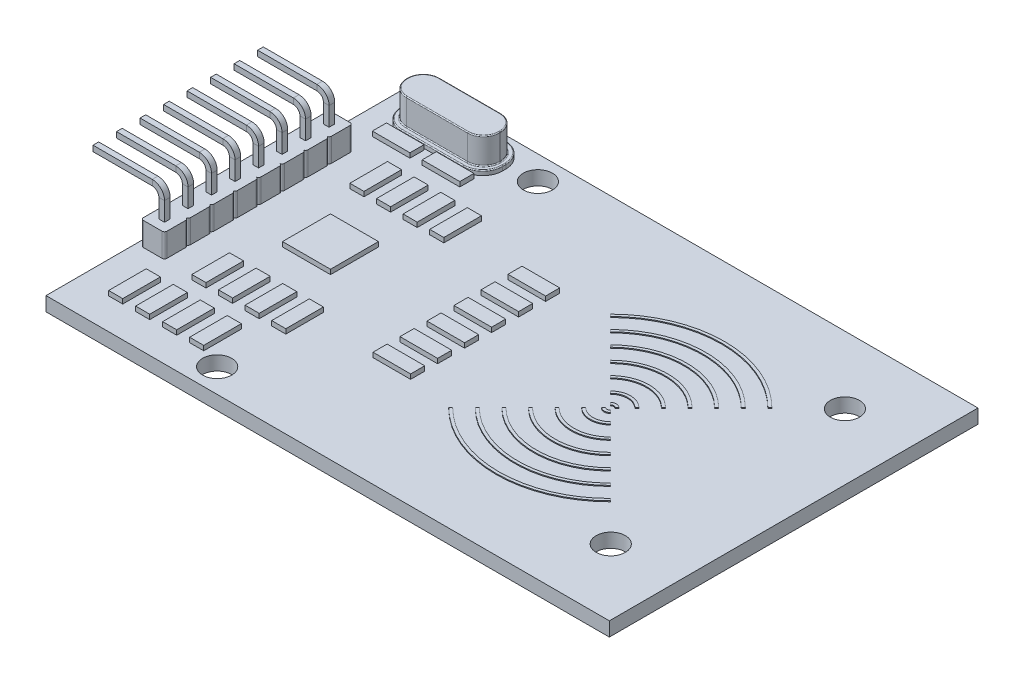
from build123d import *

# Parameters (mm, degrees)
SKETCH1_W               = 59.9
SKETCH1_H               = 39.2
BOSS_EXTRUDE1_DEPTH     = 1.5
SKETCH2_R               = 1.55
CUT_EXTRUDE4_DEPTH      = 1.5
SKETCH3_W               = 2.5
SKETCH3_H               = 2.5
BOSS_EXTRUDE2_DEPTH     = 2.5
FILLET1_R               = 0.25
LPATTERN2_START         = 1.5
LPATTERN2_DEPTH         = 2.5
SKETCH4_W               = 0.6
SKETCH4_H               = 0.6
CUT_EXTRUDE5_DEPTH      = 37.016142214
LPATTERN3_COUNT         = 8
LPATTERN3_PITCH         = 2.5
SKETCH6_W               = 0.6
SKETCH6_H               = 0.6
LPATTERN4_COUNT         = 8
LPATTERN4_PITCH         = 2.5
BOSS_EXTRUDE3_DEPTH     = 0.5
BOSS_EXTRUDE4_DEPTH     = 2.8
FILLET2_R               = 0.1
BOSS_EXTRUDE5_DEPTH     = 0.1
SKETCH14_W              = 5.1
SKETCH14_H              = 5.1
BOSS_EXTRUDE6_DEPTH     = 0.5
SKETCH15_W              = 4
SKETCH15_H              = 1.5
BOSS_EXTRUDE7_DEPTH     = 0.5
LPATTERN5_COUNT         = 6
LPATTERN5_PITCH         = 2.87
SKETCH16_W              = 1.5
SKETCH16_H              = 4
BOSS_EXTRUDE8_DEPTH     = 0.5
LPATTERN6_COUNT         = 4
LPATTERN6_PITCH         = 2.83
MIRROR2_COPY_1_SKETCH_W = 1.5
MIRROR2_COPY_1_SKETCH_H = 4
MIRROR2_COPY_1_DEPTH    = 0.5
MIRROR2_COPY_2_SKETCH_W = 1.5
MIRROR2_COPY_2_SKETCH_H = 4
MIRROR2_COPY_2_DEPTH    = 0.5
MIRROR2_COPY_3_SKETCH_W = 1.5
MIRROR2_COPY_3_SKETCH_H = 4
MIRROR2_COPY_3_DEPTH    = 0.5
SKETCH17_W              = 1.5
SKETCH17_H              = 4
BOSS_EXTRUDE9_DEPTH     = 0.5
LPATTERN7_COUNT         = 4
LPATTERN7_PITCH         = 2.87
SKETCH18_W              = 4
SKETCH18_H              = 1.5
BOSS_EXTRUDE10_DEPTH    = 0.5
LPATTERN8_COUNT         = 2
LPATTERN8_PITCH         = 5.3


# Read off the part's stored shape, not the designer's step: LPattern2
with BuildPart() as part:
    # Sketch1 → Boss-Extrude1 (new body)
    with BuildSketch(Plane(origin=(0, 0, 0), x_dir=(1, 0, 0), z_dir=(0, 1, 0))):
        Rectangle(SKETCH1_W, SKETCH1_H)
    extrude(amount=BOSS_EXTRUDE1_DEPTH)

    # Sketch2 → Cut-Extrude4 (cut)
    with BuildSketch(Plane(origin=(0, 0, 0), x_dir=(1, 0, 0), z_dir=(0, 1, 0))):
        with Locations(Location((-14.3, 17.05, 0), (0, 0, 270))):
            Circle(SKETCH2_R)
        with Locations(Location((22.95, 12.45, 0), (0, 0, 270))):
            Circle(SKETCH2_R)
        with Locations(Location((22.95, -12.45, 0), (0, 0, 90))):
            Circle(SKETCH2_R)
        with Locations(Location((-14.3, -17.05, 0), (0, 0, 90))):
            Circle(SKETCH2_R)
    extrude(amount=CUT_EXTRUDE4_DEPTH, mode=Mode.SUBTRACT)

    # Sketch3 → Boss-Extrude2 (add)
    with BuildSketch(Plane(origin=(0, 1.5, 0), x_dir=(1, 0, 0), z_dir=(0, 1, 0))):
        with Locations((-28.2, 8.75)):
            Rectangle(SKETCH3_W, SKETCH3_H)
    extrude(amount=BOSS_EXTRUDE2_DEPTH)

    # Fillet1
    fillet1_edges = [part.edges().sort_by_distance(p)[0] for p in [
        (-29.45, 2.75, -7.5),
        (-26.95, 2.75, -7.5),
        (-26.95, 2.75, -10),
        (-29.45, 2.75, -10),
    ]]
    fillet(fillet1_edges, radius=FILLET1_R)

    # LPattern2 outline → LPattern2 (add)
    with BuildSketch(Plane(origin=(0, 0, 0), x_dir=(1, 0, 0), z_dir=(0, 1, 0)).offset(LPATTERN2_START)):
        with BuildLine():
            Line((-26.95, 5.25), (-26.95, 7.25))
            ThreePointArc((-26.95, 7.25), (-27.023223305, 7.426776695), (-27.2, 7.5))
            Line((-27.2, 7.5), (-29.2, 7.5))
            ThreePointArc((-29.2, 7.5), (-29.376776695, 7.426776695), (-29.45, 7.25))
            Line((-29.45, 7.25), (-29.45, 5.25))
            ThreePointArc((-29.45, 5.25), (-29.376776695, 5.073223305), (-29.2, 5))
            ThreePointArc((-29.2, 5), (-29.376776695, 4.926776695), (-29.45, 4.75))
            Line((-29.45, 4.75), (-29.45, 2.75))
            ThreePointArc((-29.45, 2.75), (-29.376776695, 2.573223305), (-29.2, 2.5))
            ThreePointArc((-29.2, 2.5), (-29.376776695, 2.426776695), (-29.45, 2.25))
            Line((-29.45, 2.25), (-29.45, 0.25))
            ThreePointArc((-29.45, 0.25), (-29.376776695, 0.073223305), (-29.2, 0))
            ThreePointArc((-29.2, 0), (-29.376776695, -0.073223305), (-29.45, -0.25))
            Line((-29.45, -0.25), (-29.45, -2.25))
            ThreePointArc((-29.45, -2.25), (-29.376776695, -2.426776695), (-29.2, -2.5))
            ThreePointArc((-29.2, -2.5), (-29.376776695, -2.573223305), (-29.45, -2.75))
            Line((-29.45, -2.75), (-29.45, -4.75))
            ThreePointArc((-29.45, -4.75), (-29.376776695, -4.926776695), (-29.2, -5))
            ThreePointArc((-29.2, -5), (-29.376776695, -5.073223305), (-29.45, -5.25))
            Line((-29.45, -5.25), (-29.45, -7.25))
            ThreePointArc((-29.45, -7.25), (-29.376776695, -7.426776695), (-29.2, -7.5))
            ThreePointArc((-29.2, -7.5), (-29.376776695, -7.573223305), (-29.45, -7.75))
            Line((-29.45, -7.75), (-29.45, -9.75))
            ThreePointArc((-29.45, -9.75), (-29.376776695, -9.926776695), (-29.2, -10))
            Line((-29.2, -10), (-27.2, -10))
            ThreePointArc((-27.2, -10), (-27.023223305, -9.926776695), (-26.95, -9.75))
            Line((-26.95, -9.75), (-26.95, -7.75))
            ThreePointArc((-26.95, -7.75), (-27.023223305, -7.573223305), (-27.2, -7.5))
            ThreePointArc((-27.2, -7.5), (-27.023223305, -7.426776695), (-26.95, -7.25))
            Line((-26.95, -7.25), (-26.95, -5.25))
            ThreePointArc((-26.95, -5.25), (-27.023223305, -5.073223305), (-27.2, -5))
            ThreePointArc((-27.2, -5), (-27.023223305, -4.926776695), (-26.95, -4.75))
            Line((-26.95, -4.75), (-26.95, -2.75))
            ThreePointArc((-26.95, -2.75), (-27.023223305, -2.573223305), (-27.2, -2.5))
            ThreePointArc((-27.2, -2.5), (-27.023223305, -2.426776695), (-26.95, -2.25))
            Line((-26.95, -2.25), (-26.95, -0.25))
            ThreePointArc((-26.95, -0.25), (-27.023223305, -0.073223305), (-27.2, 0))
            ThreePointArc((-27.2, 0), (-27.023223305, 0.073223305), (-26.95, 0.25))
            Line((-26.95, 0.25), (-26.95, 2.25))
            ThreePointArc((-26.95, 2.25), (-27.023223305, 2.426776695), (-27.2, 2.5))
            ThreePointArc((-27.2, 2.5), (-27.023223305, 2.573223305), (-26.95, 2.75))
            Line((-26.95, 2.75), (-26.95, 4.75))
            ThreePointArc((-26.95, 4.75), (-27.023223305, 4.926776695), (-27.2, 5))
            ThreePointArc((-27.2, 5), (-27.023223305, 5.073223305), (-26.95, 5.25))
        make_face()
    extrude(amount=LPATTERN2_DEPTH)

    # Sketch4 → Cut-Extrude5 (cut, through all)
    with BuildSketch(Plane(origin=(0, 4, 0), x_dir=(1, 0, 0), z_dir=(0, 1, 0))):
        with Locations((-28.2, 8.75)):
            Rectangle(SKETCH4_W, SKETCH4_H)
    cut_extrude5 = extrude(amount=-CUT_EXTRUDE5_DEPTH, mode=Mode.SUBTRACT)

    # LPattern3: Cut-Extrude5 ×8
    with Locations(*[(0, 0, i * LPATTERN3_PITCH) for i in range(1, LPATTERN3_COUNT)]):
        add(cut_extrude5, mode=Mode.SUBTRACT)

    # Sweep1: sweep along a path in Sketch10
    with BuildLine(Plane(origin=(0, 0, -10), x_dir=(-1, 0, 0), z_dir=(0, 0, -1))) as sweep1_path:
        Line((28.2, -1), (28.2, 6))
        ThreePointArc((28.2, 6), (28.492893219, 6.707106781), (29.2, 7))
        Line((29.2, 7), (35.5, 7))
    # Sketch6 → Sweep1 (sweep)
    with BuildSketch(Plane(origin=(0, -1, 0), x_dir=(-1, 0, 0), z_dir=(0, -1, 0))):
        with Locations((28.2, 8.75)):
            Rectangle(SKETCH6_W, SKETCH6_H)
    sweep1 = sweep(path=sweep1_path.line)

    # LPattern4: Sweep1 ×8
    with Locations(*[(0, 0, i * LPATTERN4_PITCH) for i in range(1, LPATTERN4_COUNT)]):
        add(sweep1)

    # Sketch11 → Boss-Extrude3 (add)
    with BuildSketch(Plane(origin=(0, 1.5, 0), x_dir=(1, 0, 0), z_dir=(0, 1, 0))):
        with BuildLine():
            Line((-25.85, 18.6), (-19.25, 18.6))
            ThreePointArc((-19.25, 18.6), (-17.76507576, 17.98492424), (-17.15, 16.5))
            Line((-17.15, 16.5), (-17.15, 16.15))
            ThreePointArc((-17.15, 16.15), (-17.76507576, 14.66507576), (-19.25, 14.05))
            Line((-19.25, 14.05), (-25.85, 14.05))
            ThreePointArc((-25.85, 14.05), (-27.33492424, 14.66507576), (-27.95, 16.15))
            Line((-27.95, 16.15), (-27.95, 16.5))
            ThreePointArc((-27.95, 16.5), (-27.33492424, 17.98492424), (-25.85, 18.6))
        make_face()
    extrude(amount=BOSS_EXTRUDE3_DEPTH)

    # Sketch12 → Boss-Extrude4 (add)
    with BuildSketch(Plane(origin=(0, 2, 0), x_dir=(1, 0, 0), z_dir=(0, 1, 0))):
        with BuildLine():
            Line((-25.8, 18.075), (-19.3, 18.075))
            ThreePointArc((-19.3, 18.075), (-18.097918472, 17.577081528), (-17.6, 16.375))
            Line((-17.6, 16.375), (-17.6, 16.275))
            ThreePointArc((-17.6, 16.275), (-18.097918472, 15.072918472), (-19.3, 14.575))
            Line((-19.3, 14.575), (-25.8, 14.575))
            ThreePointArc((-25.8, 14.575), (-27.002081528, 15.072918472), (-27.5, 16.275))
            Line((-27.5, 16.275), (-27.5, 16.375))
            ThreePointArc((-27.5, 16.375), (-27.002081528, 17.577081528), (-25.8, 18.075))
        make_face()
    extrude(amount=BOSS_EXTRUDE4_DEPTH)

    # Fillet2
    fillet2_edges = [part.edges().sort_by_distance(p)[0] for p in [
        (-17.76507576, 2, -17.98492424),
        (-22.55, 2, -18.6),
        (-27.33492424, 2, -17.98492424),
        (-27.95, 2, -16.325),
        (-27.33492424, 2, -14.66507576),
        (-22.55, 2, -14.05),
        (-17.76507576, 2, -14.66507576),
        (-17.15, 2, -16.325),
        (-18.097918472, 2, -15.072918472),
        (-17.6, 2, -16.325),
        (-18.097918472, 2, -17.577081528),
        (-22.55, 2, -18.075),
        (-27.002081528, 2, -17.577081528),
        (-27.5, 2, -16.325),
        (-27.002081528, 2, -15.072918472),
        (-22.55, 2, -14.575),
        (-18.097918472, 4.8, -15.072918472),
        (-17.6, 4.8, -16.325),
        (-18.097918472, 4.8, -17.577081528),
        (-22.55, 4.8, -18.075),
        (-27.002081528, 4.8, -17.577081528),
        (-27.5, 4.8, -16.325),
        (-27.002081528, 4.8, -15.072918472),
        (-22.55, 4.8, -14.575),
    ]]
    fillet(fillet2_edges, radius=FILLET2_R)

    # Sketch13 → Boss-Extrude5 (add)
    with BuildSketch(Plane(origin=(0, 1.5, 0), x_dir=(1, 0, 0), z_dir=(0, 1, 0))):
        with BuildLine():
            Line((1.858652609, -8.591347391), (2.070784643, -8.379215357))
            ThreePointArc((2.070784643, -8.379215357), (10.45, -11.85), (18.829215357, -8.379215357))
            Line((18.829215357, -8.379215357), (19.041347391, -8.591347391))
            ThreePointArc((19.041347391, -8.591347391), (10.45, -12.15), (1.858652609, -8.591347391))
        make_face()
        with BuildLine():
            Line((3.272866171, -7.177133829), (3.484998205, -6.965001795))
            ThreePointArc((3.484998205, -6.965001795), (10.45, -9.85), (17.415001795, -6.965001795))
            Line((17.415001795, -6.965001795), (17.627133829, -7.177133829))
            ThreePointArc((17.627133829, -7.177133829), (10.45, -10.15), (3.272866171, -7.177133829))
        make_face()
        with BuildLine():
            Line((4.687079733, -5.762920267), (4.899211768, -5.550788232))
            ThreePointArc((4.899211768, -5.550788232), (10.45, -7.85), (16.000788232, -5.550788232))
            Line((16.000788232, -5.550788232), (16.212920267, -5.762920267))
            ThreePointArc((16.212920267, -5.762920267), (10.45, -8.15), (4.687079733, -5.762920267))
        make_face()
        with BuildLine():
            Line((6.101293296, -4.348706704), (6.31342533, -4.13657467))
            ThreePointArc((6.31342533, -4.13657467), (10.45, -5.85), (14.58657467, -4.13657467))
            Line((14.58657467, -4.13657467), (14.798706704, -4.348706704))
            ThreePointArc((14.798706704, -4.348706704), (10.45, -6.15), (6.101293296, -4.348706704))
        make_face()
        with BuildLine():
            Line((7.515506858, -2.934493142), (7.727638892, -2.722361108))
            ThreePointArc((7.727638892, -2.722361108), (10.45, -3.85), (13.172361108, -2.722361108))
            Line((13.172361108, -2.722361108), (13.384493142, -2.934493142))
            ThreePointArc((13.384493142, -2.934493142), (10.45, -4.15), (7.515506858, -2.934493142))
        make_face()
        with BuildLine():
            Line((8.92972042, -1.52027958), (9.141852455, -1.308147545))
            ThreePointArc((9.141852455, -1.308147545), (10.45, -1.85), (11.758147545, -1.308147545))
            Line((11.758147545, -1.308147545), (11.97027958, -1.52027958))
            ThreePointArc((11.97027958, -1.52027958), (10.45, -2.15), (8.92972042, -1.52027958))
        make_face()
        with BuildLine():
            Line((9.990380592, -0.459619408), (10.202512627, -0.247487373))
            ThreePointArc((10.202512627, -0.247487373), (10.45, -0.35), (10.697487373, -0.247487373))
            Line((10.697487373, -0.247487373), (10.909619408, -0.459619408))
            ThreePointArc((10.909619408, -0.459619408), (10.45, -0.65), (9.990380592, -0.459619408))
        make_face()
    boss_extrude5 = extrude(amount=BOSS_EXTRUDE5_DEPTH)

    # Mirror1: Boss-Extrude5 across plane
    add(boss_extrude5.mirror(Plane.XY))

    # Sketch14 → Boss-Extrude6 (add)
    with BuildSketch(Plane(origin=(0, 1.5, 0), x_dir=(1, 0, 0), z_dir=(0, 1, 0))):
        with Locations((-19.3, 0)):
            Rectangle(SKETCH14_W, SKETCH14_H)
    extrude(amount=BOSS_EXTRUDE6_DEPTH)

    # Sketch15 → Boss-Extrude7 (add)
    with BuildSketch(Plane(origin=(0, 1.5, 0), x_dir=(1, 0, 0), z_dir=(0, 1, 0))):
        with Locations((-4.85, -7.18)):
            Rectangle(SKETCH15_W, SKETCH15_H)
    boss_extrude7 = extrude(amount=BOSS_EXTRUDE7_DEPTH)

    # LPattern5: Boss-Extrude7 ×6
    with Locations(*[(0, 0, -i * LPATTERN5_PITCH) for i in range(1, LPATTERN5_COUNT)]):
        add(boss_extrude7)

    # Sketch16 → Boss-Extrude8 (add)
    with BuildSketch(Plane(origin=(0, 1.5, 0), x_dir=(1, 0, 0), z_dir=(0, 1, 0))):
        with Locations((-14.4, 8.4)):
            Rectangle(SKETCH16_W, SKETCH16_H)
    boss_extrude8 = extrude(amount=BOSS_EXTRUDE8_DEPTH)

    # LPattern6: Boss-Extrude8 ×4
    with Locations(*[(-i * LPATTERN6_PITCH, 0, 0) for i in range(1, LPATTERN6_COUNT)]):
        add(boss_extrude8)

    # Mirror2: Boss-Extrude8 across plane
    add(boss_extrude8.mirror(Plane.XY))

    # Mirror2 copy 1 sketch → Mirror2 copy 1 (add)
    with BuildSketch(Plane(origin=(-2.83, 1.5, 0), x_dir=(1, 0, 0), z_dir=(0, 1, 0))):
        with Locations((-14.4, -8.4)):
            Rectangle(MIRROR2_COPY_1_SKETCH_W, MIRROR2_COPY_1_SKETCH_H)
    extrude(amount=MIRROR2_COPY_1_DEPTH)

    # Mirror2 copy 2 sketch → Mirror2 copy 2 (add)
    with BuildSketch(Plane(origin=(-5.66, 1.5, 0), x_dir=(1, 0, 0), z_dir=(0, 1, 0))):
        with Locations((-14.4, -8.4)):
            Rectangle(MIRROR2_COPY_2_SKETCH_W, MIRROR2_COPY_2_SKETCH_H)
    extrude(amount=MIRROR2_COPY_2_DEPTH)

    # Mirror2 copy 3 sketch → Mirror2 copy 3 (add)
    with BuildSketch(Plane(origin=(-8.49, 1.5, 0), x_dir=(1, 0, 0), z_dir=(0, 1, 0))):
        with Locations((-14.4, -8.4)):
            Rectangle(MIRROR2_COPY_3_SKETCH_W, MIRROR2_COPY_3_SKETCH_H)
    extrude(amount=MIRROR2_COPY_3_DEPTH)

    # Sketch17 → Boss-Extrude9 (add)
    with BuildSketch(Plane(origin=(0, 1.5, 0), x_dir=(1, 0, 0), z_dir=(0, 1, 0))):
        with Locations((-17.23, -14.3)):
            Rectangle(SKETCH17_W, SKETCH17_H)
    boss_extrude9 = extrude(amount=BOSS_EXTRUDE9_DEPTH)

    # LPattern7: Boss-Extrude9 ×4
    with Locations(*[(-i * LPATTERN7_PITCH, 0, 0) for i in range(1, LPATTERN7_COUNT)]):
        add(boss_extrude9)

    # Sketch18 → Boss-Extrude10 (add)
    with BuildSketch(Plane(origin=(0, 1.5, 0), x_dir=(1, 0, 0), z_dir=(0, 1, 0))):
        with Locations((-19.95, 13.15)):
            Rectangle(SKETCH18_W, SKETCH18_H)
    boss_extrude10 = extrude(amount=BOSS_EXTRUDE10_DEPTH)

    # LPattern8: Boss-Extrude10 ×2
    with Locations(*[(-i * LPATTERN8_PITCH, 0, 0) for i in range(1, LPATTERN8_COUNT)]):
        add(boss_extrude10)


solid = part.part
